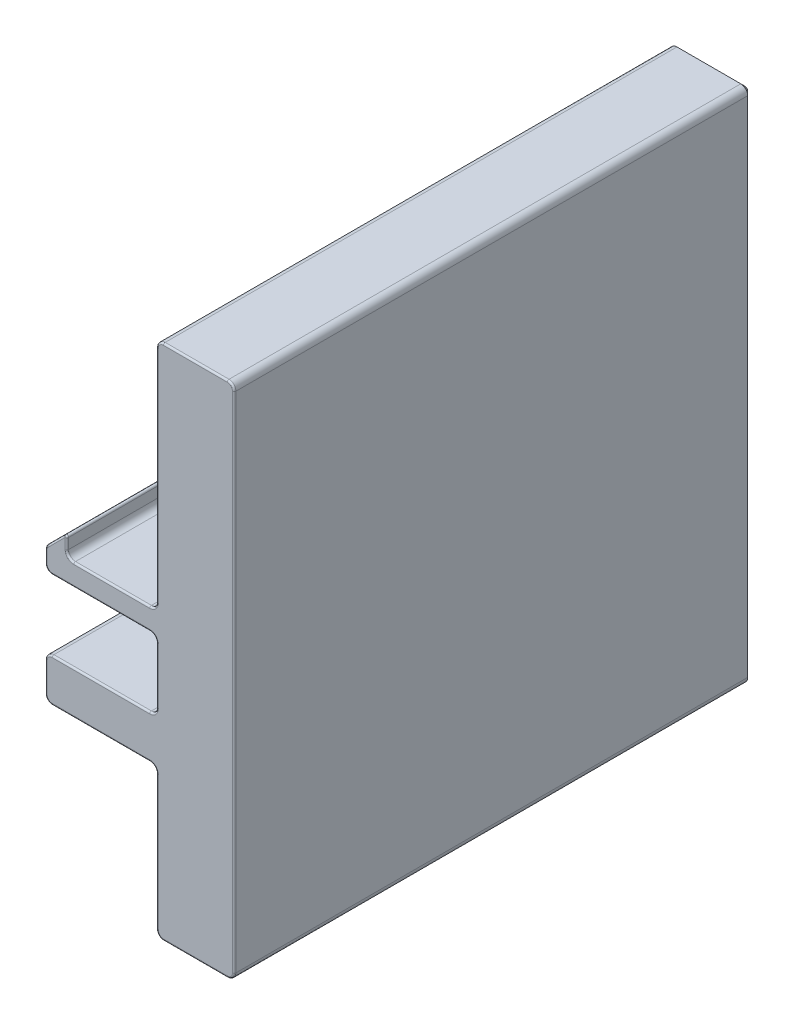
from build123d import *

# Parameters (mm, degrees)
BOSS_EXTRUDE1_DEPTH = 38.1
FILLET1_R           = 0.508
FILLET2_R           = 0.127
CHAMFER1_SIZE       = 0.3
FILLET3_R           = 0.127


with BuildPart() as part:
    # Sketch1 → Boss-Extrude1 (new body)
    with BuildSketch(Plane.XY):
        Polygon((0, 0), (5.715, 0), (5.715, 38.1), (0, 38.1), (0, 20.828), (-6.604, 20.828), (-6.604, 22.4155), (-8.1915, 20.828), (-8.1915, 19.2405), (0, 19.2405), (0, 14.097), (-8.1915, 14.097), (-8.1915, 10.922), (0, 10.922), align=None)
    extrude(amount=BOSS_EXTRUDE1_DEPTH)

    # Fillet1
    fillet1_edges = [part.edges().sort_by_distance(p)[0] for p in [
        (0, 0, 19.05),
        (0, 10.922, 19.05),
        (-8.1915, 10.922, 19.05),
        (-8.1915, 14.097, 19.05),
        (0, 14.097, 19.05),
        (0, 19.2405, 19.05),
        (-8.1915, 19.2405, 19.05),
        (-8.1915, 20.828, 19.05),
        (-6.604, 20.828, 19.05),
        (0, 20.828, 19.05),
        (0, 38.1, 19.05),
        (5.715, 38.1, 19.05),
        (5.715, 0, 19.05),
    ]]
    fillet(fillet1_edges, radius=FILLET1_R)

    # Fillet2
    fillet2_edges = [part.edges().sort_by_distance(p)[0] for p in [
        (-6.604, 22.4155, 19.05),
    ]]
    fillet(fillet2_edges, radius=FILLET2_R)

    # Chamfer1
    # the kernel refuses this chamfer: 0.3 mm, written as the material it takes off along each edge
    with BuildSketch(Plane(origin=(-6.275266217, 22.744233783, 0), x_dir=(0.7068394360706772, -0.7068394360706697, -0.02749587661058634), z_dir=(-0.7071067811865438, -0.7071067811865513, 0))) as chamfer1_piece_1:
        Polygon((CHAMFER1_SIZE * 0.999621916911, CHAMFER1_SIZE * 0.0274958766106), (-CHAMFER1_SIZE * 0.0274958766106, CHAMFER1_SIZE * 0.999621916911), (0, 0), align=None)
    extrude(amount=2.499543315, mode=Mode.SUBTRACT)
    with BuildSketch(Plane(origin=(-7.6835, 19.2405, 0), x_dir=(0, 0.9996219169112968, -0.02749587661058633), z_dir=(1, 0, 0)), Plane(origin=(-7.6835, 10.922, 0), x_dir=(0, 0.9996219169112968, -0.02749587661058633), z_dir=(1, 0, 0)), Plane(origin=(-0.508, 14.097, 0), x_dir=(0, -0.9996219169112968, -0.02749587661058633), z_dir=(-1, 0, 0))) as chamfer1_piece_2:
        Polygon((CHAMFER1_SIZE * 0.999621916911, CHAMFER1_SIZE * 0.0274958766106), (-CHAMFER1_SIZE * 0.0274958766106, CHAMFER1_SIZE * 0.999621916911), (0, 0), align=None)
    extrude(amount=7.1755, mode=Mode.SUBTRACT)
    with BuildSketch(Plane(origin=(0.508, 0, 0), x_dir=(0, 0.9996219169112968, -0.027495876610586275), z_dir=(1, 0, 0)), Plane(origin=(5.207, 38.1, 0), x_dir=(0, -0.9996219169112968, -0.027495876610586494), z_dir=(-1, 0, 0))) as chamfer1_piece_3:
        Polygon((CHAMFER1_SIZE * 0.999621916911, CHAMFER1_SIZE * 0.0274958766106), (-CHAMFER1_SIZE * 0.0274958766106, CHAMFER1_SIZE * 0.999621916911), (0, 0), align=None)
    extrude(amount=4.699, mode=Mode.SUBTRACT)
    with BuildSketch(Plane(origin=(0, 10.414, 0), x_dir=(0.9996219169112968, 0, -0.02749587661058637), z_dir=(0, -1, 0))) as chamfer1_piece_4:
        Polygon((CHAMFER1_SIZE * 0.999621916911, CHAMFER1_SIZE * 0.0274958766106), (-CHAMFER1_SIZE * 0.0274958766106, CHAMFER1_SIZE * 0.999621916911), (0, 0), align=None)
    extrude(amount=9.906, mode=Mode.SUBTRACT)
    with BuildSketch(Plane(origin=(-8.1915, 13.589, 0), x_dir=(0.9996219169112968, 0, -0.02749587661058637), z_dir=(0, -1, 0))) as chamfer1_piece_5:
        Polygon((CHAMFER1_SIZE * 0.999621916911, CHAMFER1_SIZE * 0.0274958766106), (-CHAMFER1_SIZE * 0.0274958766106, CHAMFER1_SIZE * 0.999621916911), (0, 0), align=None)
    extrude(amount=2.159, mode=Mode.SUBTRACT)
    with BuildSketch(Plane(origin=(0, 18.7325, 0), x_dir=(0.9996219169112968, 0, -0.02749587661058637), z_dir=(0, -1, 0))) as chamfer1_piece_6:
        Polygon((CHAMFER1_SIZE * 0.999621916911, CHAMFER1_SIZE * 0.0274958766106), (-CHAMFER1_SIZE * 0.0274958766106, CHAMFER1_SIZE * 0.999621916911), (0, 0), align=None)
    extrude(amount=4.1275, mode=Mode.SUBTRACT)
    with BuildSketch(Plane(origin=(-8.1915, 20.61757951, 0), x_dir=(0.9996219169112968, 1.118541876484896e-15, -0.02749587661058637), z_dir=(0, -1, 0))) as chamfer1_piece_7:
        Polygon((CHAMFER1_SIZE * 0.999621916911, CHAMFER1_SIZE * 0.0274958766106), (-CHAMFER1_SIZE * 0.0274958766106, CHAMFER1_SIZE * 0.999621916911), (0, 0), align=None)
    extrude(amount=0.86907951, mode=Mode.SUBTRACT)
    with BuildSketch(Plane(origin=(-6.604, 21.336, 0), x_dir=(-0.9996219169112968, 0, -0.02749587661058637), z_dir=(0, 1, 0))) as chamfer1_piece_8:
        Polygon((CHAMFER1_SIZE * 0.999621916911, CHAMFER1_SIZE * 0.0274958766106), (-CHAMFER1_SIZE * 0.0274958766106, CHAMFER1_SIZE * 0.999621916911), (0, 0), align=None)
    extrude(amount=1.544399774, mode=Mode.SUBTRACT)
    with BuildSketch(Plane(origin=(-0.508, 20.828, 0), x_dir=(0, -0.9996219169112968, -0.02749587661058633), z_dir=(-1, 0, 0))) as chamfer1_piece_9:
        Polygon((CHAMFER1_SIZE * 0.999621916911, CHAMFER1_SIZE * 0.0274958766106), (-CHAMFER1_SIZE * 0.0274958766106, CHAMFER1_SIZE * 0.999621916911), (0, 0), align=None)
    extrude(amount=5.588, mode=Mode.SUBTRACT)
    with BuildSketch(Plane(origin=(0, 37.592, 0), x_dir=(0.9996219169112968, 0, -0.02749587661058637), z_dir=(0, -1, 0))) as chamfer1_piece_10:
        Polygon((CHAMFER1_SIZE * 0.999621916911, CHAMFER1_SIZE * 0.0274958766106), (-CHAMFER1_SIZE * 0.0274958766106, CHAMFER1_SIZE * 0.999621916911), (0, 0), align=None)
    extrude(amount=16.256, mode=Mode.SUBTRACT)
    with BuildSketch(Plane(origin=(5.715, 0.508, 0), x_dir=(-0.9996219169112968, 0, -0.02749587661058637), z_dir=(0, 1, 0))) as chamfer1_piece_11:
        Polygon((CHAMFER1_SIZE * 0.999621916911, CHAMFER1_SIZE * 0.0274958766106), (-CHAMFER1_SIZE * 0.0274958766106, CHAMFER1_SIZE * 0.999621916911), (0, 0), align=None)
    extrude(amount=37.084, mode=Mode.SUBTRACT)
    with BuildSketch(Plane(origin=(-7.6835, 13.589, 0), x_dir=(0, 1, 0), z_dir=(1, 0, 0))) as chamfer1_piece_12:
        Polygon((0.508 - CHAMFER1_SIZE, 0), (0.508, CHAMFER1_SIZE), (0.508, 0), align=None)
    revolve(axis=Axis((-7.6835, 13.589, 0), (0, 0, 1)), revolution_arc=90, mode=Mode.SUBTRACT)
    with BuildSketch(Plane(origin=(-7.6835, 11.43, 0), x_dir=(-1, 0, 0), z_dir=(0, 1, 0))) as chamfer1_piece_13:
        Polygon((0.508 - CHAMFER1_SIZE, 0), (0.508, CHAMFER1_SIZE), (0.508, 0), align=None)
    revolve(axis=Axis((-7.6835, 11.43, 0), (0, 0, 1)), revolution_arc=90, mode=Mode.SUBTRACT)
    with BuildSketch(Plane(origin=(0.508, 0.508, 0), x_dir=(0, -1, 0), z_dir=(1, 0, 0))) as chamfer1_piece_14:
        Polygon((0.508 - CHAMFER1_SIZE, 0), (0.508, -CHAMFER1_SIZE), (0.508, 0), align=None)
    revolve(axis=Axis((0.508, 0.508, 0), (0, 0, -1)), revolution_arc=90, mode=Mode.SUBTRACT)
    with BuildSketch(Plane(origin=(0.508, 37.592, 0), x_dir=(0, 1, 0), z_dir=(1, 0, 0))) as chamfer1_piece_15:
        Polygon((0.508 - CHAMFER1_SIZE, 0), (0.508, CHAMFER1_SIZE), (0.508, 0), align=None)
    revolve(axis=Axis((0.508, 37.592, 0), (0, 0, 1)), revolution_arc=90, mode=Mode.SUBTRACT)
    with BuildSketch(Plane(origin=(5.207, 0.508, 0), x_dir=(0, -1, 0), z_dir=(-1, 0, 0))) as chamfer1_piece_16:
        Polygon((0.508 - CHAMFER1_SIZE, 0), (0.508, CHAMFER1_SIZE), (0.508, 0), align=None)
    revolve(axis=Axis((5.207, 0.508, 0), (0, 0, 1)), revolution_arc=90, mode=Mode.SUBTRACT)
    with BuildSketch(Plane(origin=(5.207, 37.592, 0), x_dir=(1, 0, 0), z_dir=(0, -1, 0))) as chamfer1_piece_17:
        Polygon((0.508 - CHAMFER1_SIZE, 0), (0.508, CHAMFER1_SIZE), (0.508, 0), align=None)
    revolve(axis=Axis((5.207, 37.592, 0), (0, 0, 1)), revolution_arc=90, mode=Mode.SUBTRACT)
    with BuildSketch(Plane(origin=(-7.6835, 20.61757951, 0), x_dir=(-0.7071067811865519, 0.7071067811865432, 0), z_dir=(0.7071067811865432, 0.7071067811865519, 0))) as chamfer1_piece_18:
        Polygon((0.508 - CHAMFER1_SIZE, 0), (0.508, CHAMFER1_SIZE), (0.508, 0), align=None)
    revolve(axis=Axis((-7.6835, 20.61757951, 0), (0, 0, 1)), revolution_arc=45, mode=Mode.SUBTRACT)
    with BuildSketch(Plane(origin=(-7.6835, 19.7485, 0), x_dir=(-1, 0, 0), z_dir=(0, 1, 0))) as chamfer1_piece_19:
        Polygon((0.508 - CHAMFER1_SIZE, 0), (0.508, CHAMFER1_SIZE), (0.508, 0), align=None)
    revolve(axis=Axis((-7.6835, 19.7485, 0), (0, 0, 1)), revolution_arc=90, mode=Mode.SUBTRACT)
    with BuildSketch(Plane(origin=(-0.508, 14.605, 0), x_dir=(1, 0, 0), z_dir=(0, 1, 0))) as chamfer1_piece_20:
        Polygon((0.508 + CHAMFER1_SIZE, 0), (0.508, -CHAMFER1_SIZE), (0.508, 0), align=None)
    revolve(axis=Axis((-0.508, 14.605, 0), (0, 0, -1)), revolution_arc=90, mode=Mode.SUBTRACT)
    with BuildSketch(Plane(origin=(-0.508, 18.7325, 0), x_dir=(0, 1, 0), z_dir=(-1, 0, 0))) as chamfer1_piece_21:
        Polygon((0.508 + CHAMFER1_SIZE, 0), (0.508, -CHAMFER1_SIZE), (0.508, 0), align=None)
    revolve(axis=Axis((-0.508, 18.7325, 0), (0, 0, -1)), revolution_arc=90, mode=Mode.SUBTRACT)
    with BuildSketch(Plane(origin=(-0.508, 10.414, 0), x_dir=(0, 1, 0), z_dir=(-1, 0, 0))) as chamfer1_piece_22:
        Polygon((0.508 + CHAMFER1_SIZE, 0), (0.508, -CHAMFER1_SIZE), (0.508, 0), align=None)
    revolve(axis=Axis((-0.508, 10.414, 0), (0, 0, -1)), revolution_arc=90, mode=Mode.SUBTRACT)
    with BuildSketch(Plane(origin=(-6.096, 21.336, 0), x_dir=(0, -1, 0), z_dir=(1, 0, 0))) as chamfer1_piece_23:
        Polygon((0.508 + CHAMFER1_SIZE, 0), (0.508, -CHAMFER1_SIZE), (0.508, 0), align=None)
    revolve(axis=Axis((-6.096, 21.336, 0), (0, 0, -1)), revolution_arc=90, mode=Mode.SUBTRACT)
    with BuildSketch(Plane(origin=(-0.508, 21.336, 0), x_dir=(1, 0, 0), z_dir=(0, 1, 0))) as chamfer1_piece_24:
        Polygon((0.508 + CHAMFER1_SIZE, 0), (0.508, -CHAMFER1_SIZE), (0.508, 0), align=None)
    revolve(axis=Axis((-0.508, 21.336, 0), (0, 0, -1)), revolution_arc=90, mode=Mode.SUBTRACT)

    # Fillet3
    fillet3_edges = [part.edges().sort_by_distance(p)[0] for p in [
        (-7.431756403, 21.587743597, 38.1),
        (-6.682399204, 22.226227578, 38.1),
        (-4.09575, 19.2405, 38.1),
        (-8.1915, 20.183039755, 38.1),
        (2.8575, 0, 38.1),
        (5.715, 19.05, 38.1),
        (2.8575, 38.1, 38.1),
        (0, 29.464, 38.1),
        (-3.302, 20.828, 38.1),
        (-6.604, 21.722447439, 38.1),
        (0, 16.66875, 38.1),
        (-4.09575, 14.097, 38.1),
        (-8.1915, 12.5095, 38.1),
        (-4.09575, 10.922, 38.1),
        (0, 5.461, 38.1),
        (-8.042710245, 13.948210245, 38.1),
        (-8.042710245, 11.070789755, 38.1),
        (0.148789755, 0.148789755, 38.1),
        (0.148789755, 37.951210245, 38.1),
        (5.566210245, 0.148789755, 38.1),
        (5.566210245, 37.951210245, 38.1),
        (-8.152830803, 20.811982694, 38.1),
        (-8.042710245, 19.389289755, 38.1),
        (-0.148789755, 14.245789755, 38.1),
        (-0.148789755, 19.091710245, 38.1),
        (-0.148789755, 10.773210245, 38.1),
        (-6.455210245, 20.976789755, 38.1),
        (-0.148789755, 20.976789755, 38.1),
    ]]
    fillet(fillet3_edges, radius=FILLET3_R)


solid = part.part
